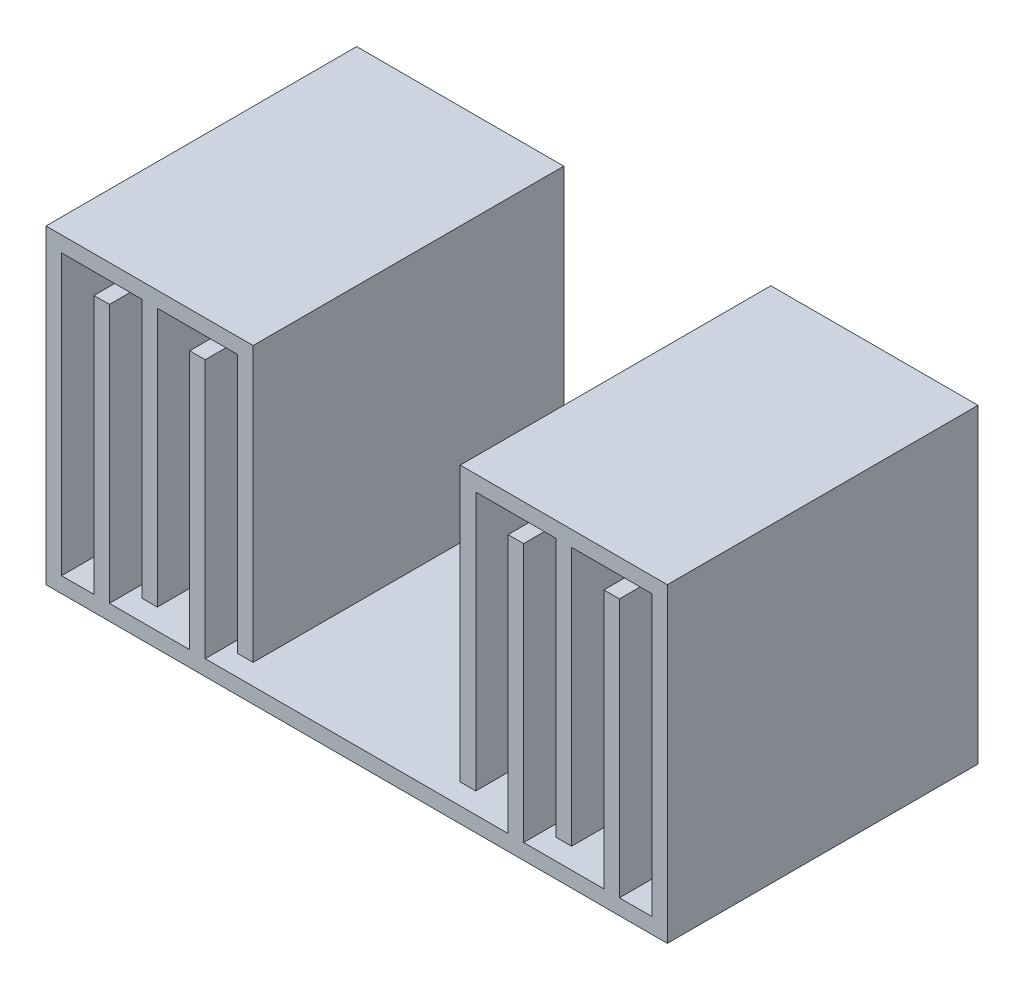
from build123d import *

# Parameters (mm, degrees)
SKETCH1_W           = 60
SKETCH1_H           = 30
BOSS_EXTRUDE1_DEPTH = 30
SKETCH2_W           = 20
SKETCH2_H           = 28.5
CUT_EXTRUDE1_DEPTH  = 46
SKETCH3_W           = 17
SKETCH3_H           = 27
CUT_EXTRUDE2_DEPTH  = 28.5
SKETCH4_W           = 1.5
SKETCH4_H           = 25
BOSS_EXTRUDE2_DEPTH = 28.5
SKETCH5_W           = 1.5
SKETCH5_H           = 2
CUT_EXTRUDE3_DEPTH  = 28.5


with BuildPart() as part:
    # Sketch1 → Boss-Extrude1 (new body)
    with BuildSketch(Plane.XY):
        Rectangle(SKETCH1_W, SKETCH1_H)
    extrude(amount=-BOSS_EXTRUDE1_DEPTH)

    # Sketch2 → Cut-Extrude1 (cut, through all)
    with BuildSketch(Plane.XY):
        with Locations((0, 0.75)):
            Rectangle(SKETCH2_W, SKETCH2_H)
    extrude(amount=-CUT_EXTRUDE1_DEPTH, mode=Mode.SUBTRACT)

    # Sketch3 → Cut-Extrude2 (cut)
    with BuildSketch(Plane.XY):
        with Locations((-20, 0)):
            Rectangle(SKETCH3_W, SKETCH3_H)
        with Locations((20, 0)):
            Rectangle(SKETCH3_W, SKETCH3_H)
    extrude(amount=-CUT_EXTRUDE2_DEPTH, mode=Mode.SUBTRACT)

    # Sketch4 → Boss-Extrude2 (add)
    with BuildSketch(Plane.XY):
        with Locations((-15.375, -1)):
            Rectangle(SKETCH4_W, SKETCH4_H)
        with Locations((-20, 1)):
            Rectangle(SKETCH4_W, SKETCH4_H)
        with Locations((-24.625, -1)):
            Rectangle(SKETCH4_W, SKETCH4_H)
        with Locations((15.375, -1)):
            Rectangle(SKETCH4_W, SKETCH4_H)
        with Locations((20, 1)):
            Rectangle(SKETCH4_W, SKETCH4_H)
        with Locations((24.625, -1)):
            Rectangle(SKETCH4_W, SKETCH4_H)
    extrude(amount=-BOSS_EXTRUDE2_DEPTH)

    # Sketch5 → Cut-Extrude3 (cut)
    with BuildSketch(Plane.XY):
        with Locations((-10.75, -12.5)):
            Rectangle(SKETCH5_W, SKETCH5_H)
        with Locations((10.75, -12.5)):
            Rectangle(SKETCH5_W, SKETCH5_H)
    extrude(amount=-CUT_EXTRUDE3_DEPTH, mode=Mode.SUBTRACT)


solid = part.part
